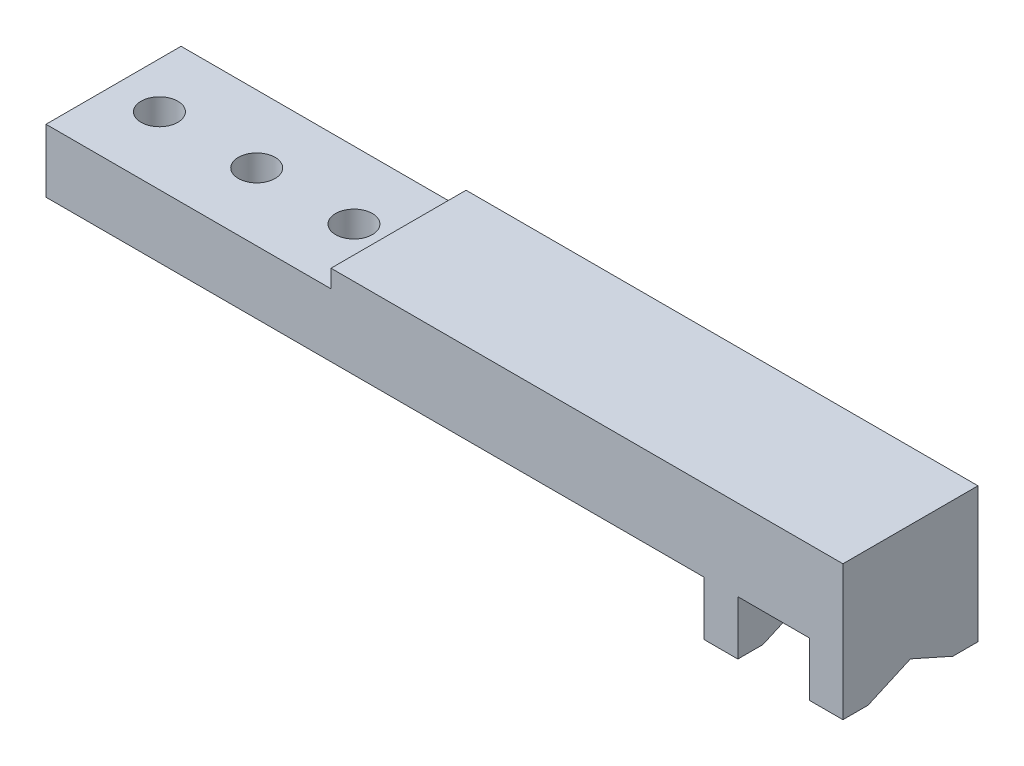
from build123d import *

# Parameters (mm, degrees)
CROQUIS1_W              = 74.93
CROQUIS1_H              = 12.7
SALIENTE_EXTRUIR1_DEPTH = 12.7
CROQUIS2_W              = 26.797
CROQUIS2_H              = 1.6764
CROQUIS2_W_2            = 6.731
CROQUIS2_H_2            = 5.08
CROQUIS2_W_3            = 61.8744
CORTAR_EXTRUIR1_DEPTH   = 78.052481466
TALADRO_ROSCADO_8_321_D = 3.4544
CORTAR_EXTRUIR4_DEPTH   = 78.052481466


with BuildPart() as part:
    # Croquis1 → Saliente-Extruir1 (new body)
    with BuildSketch(Plane(origin=(0, 0, 0), x_dir=(1, 0, 0), z_dir=(0, 1, 0))):
        with Locations((37.465, -6.35)):
            Rectangle(CROQUIS1_W, CROQUIS1_H)
    extrude(amount=SALIENTE_EXTRUIR1_DEPTH)

    # Croquis2 → Cortar-Extruir1 (cut, through all)
    with BuildSketch(Plane.XY.offset(12.7)):
        with Locations((13.3985, 11.8618)):
            Rectangle(CROQUIS2_W, CROQUIS2_H)
        with Locations((68.4149, 2.54)):
            Rectangle(CROQUIS2_W_2, CROQUIS2_H_2)
        with Locations((30.9372, 2.54)):
            Rectangle(CROQUIS2_W_3, CROQUIS2_H_2)
    extrude(amount=-CORTAR_EXTRUIR1_DEPTH, mode=Mode.SUBTRACT)

    # Taladro roscado #8-321 (through all)
    with Locations(Plane(origin=(0, 5.08, 0), x_dir=(-1, 0, 0), z_dir=(0, -1, 0))):
        with Locations((-4.318, -6.35), (-13.462, -6.35), (-22.606, -6.35)):
            Hole(TALADRO_ROSCADO_8_321_D / 2)

    # Croquis8 → Cortar-Extruir4 (cut, through all)
    with BuildSketch(Plane(origin=(74.93, 0, 0), x_dir=(0, 0, -1), z_dir=(1, 0, 0))):
        Polygon((-10.3378, 0), (-6.35, 1.778), (-2.3622, 0), align=None)
    extrude(amount=-CORTAR_EXTRUIR4_DEPTH, mode=Mode.SUBTRACT)


solid = part.part
